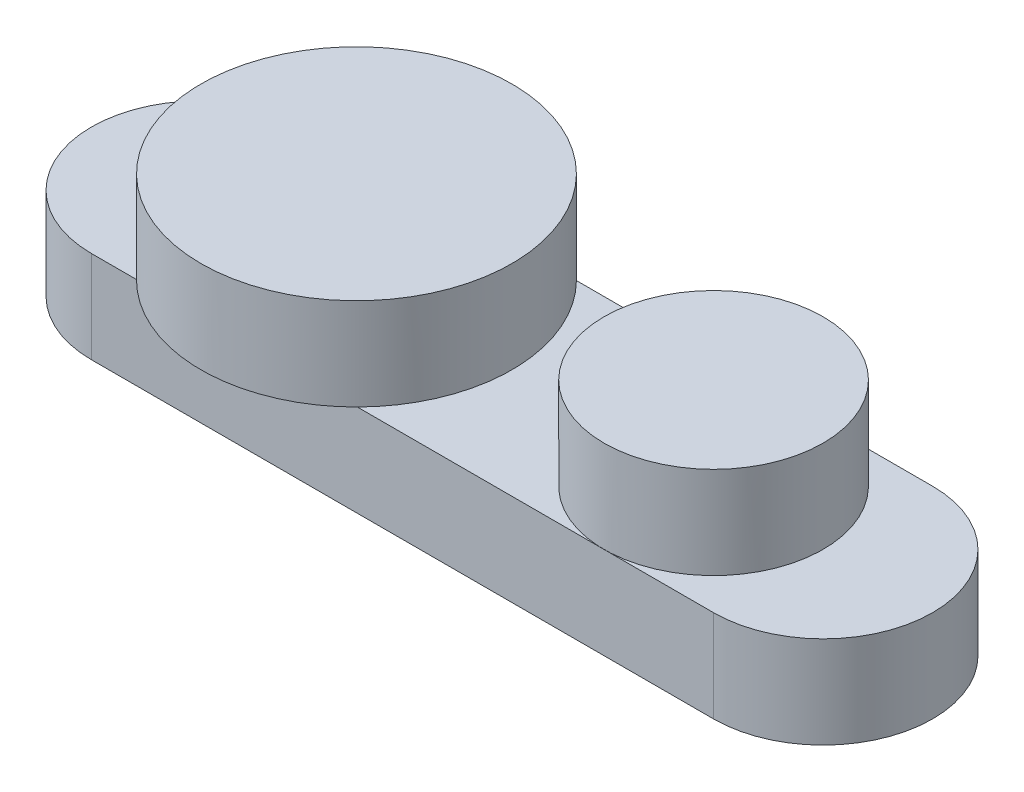
from build123d import *

# Parameters (mm, degrees)
SKETCH_1_R        = 8.45
EXTRUDE_1_DEPTH   = 5
SKETCH_1_R_2      = 5.95
EXTRUDE_1_2_DEPTH = 5
EXTRUDE_2_DEPTH   = 5


with BuildPart() as part:
    # Эскиз1 → Бобышка-Вытянуть1 (new body)
    with BuildSketch(Plane(origin=(0, 0, 0), x_dir=(1, 0, 0), z_dir=(0, 1, 0))):
        with Locations((13.45, 0)):
            Circle(SKETCH_1_R)
    extrude(amount=EXTRUDE_1_DEPTH)



with BuildPart() as body_2:
    # Эскиз1 → Extrude 1 2 (new body)
    with BuildSketch(Plane(origin=(0, 0, 0), x_dir=(1, 0, 0), z_dir=(0, 1, 0))):
        with Locations((32.85, 0)):
            Circle(SKETCH_1_R_2)
    extrude(amount=EXTRUDE_1_2_DEPTH)


with BuildPart() as part_1:
    add(part.part)

    add(body_2.part)  # Бобышка-Вытянуть2 merges body 2
    # Эскиз2 → Бобышка-Вытянуть2 (add)
    with BuildSketch(Plane.XZ):
        with BuildLine():
            Line((5, 5.95002256), (38.8, 5.95002256))
            ThreePointArc((38.8, 5.95002256), (44.75002256, 0), (38.8, -5.95002256))
            Line((38.8, -5.95002256), (5, -5.95002256))
            ThreePointArc((5, -5.95002256), (-0.95002256, 0), (5, 5.95002256))
        make_face()
    extrude(amount=EXTRUDE_2_DEPTH)


solid = part_1.part
